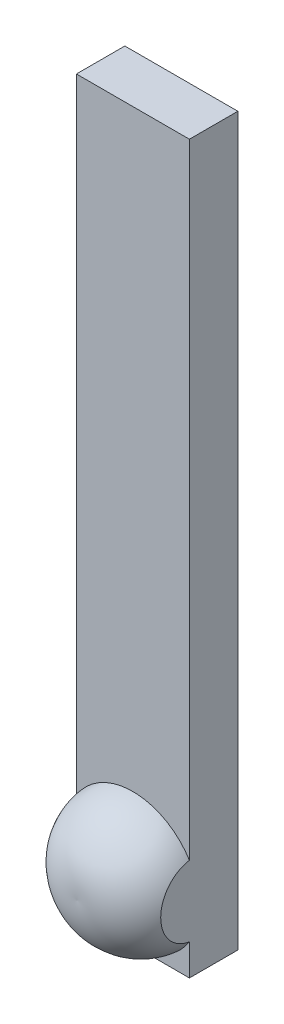
from build123d import *

# Parameters (mm, degrees)
SKETCH1_W           = 57.15
SKETCH1_H           = 8.89
BOSS_EXTRUDE1_DEPTH = 3.81
SKETCH3_W           = 1.490899844
SKETCH3_H           = 8.009324992
SKETCH3_W_2         = 1.141380791
SKETCH3_H_2         = 7.399147663
CUT_EXTRUDE1_DEPTH  = 59.543927485


with BuildPart() as part:
    # Sketch1 → Boss-Extrude1 (new body)
    with BuildSketch(Plane(origin=(0, 0, 0), x_dir=(0, 1, 0), z_dir=(0, 0, 1))):
        with Locations((28.575, 4.445)):
            Rectangle(SKETCH1_W, SKETCH1_H)
    extrude(amount=BOSS_EXTRUDE1_DEPTH)

    # Sketch2 → Revolve1 (revolve)
    with BuildSketch(Plane.YZ.offset(-4.445)):
        with BuildLine():
            Line((5.242305724, 8.192092891), (5.242305724, 3.81))
            Line((5.242305724, 3.81), (0, 3.81))
            ThreePointArc((0, 3.81), (1.713591709, 7.08676351), (5.242305724, 8.192092891))
        make_face()
    revolve(axis=Axis((-4.445, 5.242305724, 8.192092891), (0, 0, -1)))

    # Sketch3 → Cut-Extrude1 (cut, through all)
    with BuildSketch(Plane.XZ):
        with Locations((-9.635449922, 4.004662496)):
            Rectangle(SKETCH3_W, SKETCH3_H)
        with Locations((0.570690396, 3.699573832)):
            Rectangle(SKETCH3_W_2, SKETCH3_H_2)
    extrude(amount=-CUT_EXTRUDE1_DEPTH, mode=Mode.SUBTRACT)


solid = part.part
